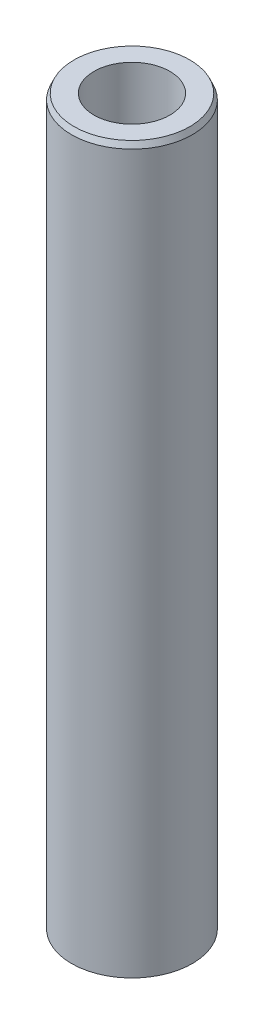
from build123d import *
from OCP.BRepFilletAPI import BRepFilletAPI_MakeChamfer

# Parameters (mm, degrees)
SKETCH1_R           = 27.5
BOSS_EXTRUDE1_DEPTH = 330.461544823
SKETCH2_R           = 17.26713165
CUT_EXTRUDE1_DEPTH  = 333.742141315
CHAMFER1_SIZE       = 2.609505567
CHAMFER1_SIZE2      = 1.168457608


with BuildPart() as part:
    # Sketch1 → Boss-Extrude1 (new body)
    with BuildSketch(Plane(origin=(0, 0, 0), x_dir=(1, 0, 0), z_dir=(0, 1, 0))):
        Circle(SKETCH1_R)
    extrude(amount=BOSS_EXTRUDE1_DEPTH)

    # Sketch2 → Cut-Extrude1 (cut, through all)
    with BuildSketch(Plane(origin=(0, 0, 0), x_dir=(1, 0, 0), z_dir=(0, 1, 0))):
        Circle(SKETCH2_R)
    extrude(amount=CUT_EXTRUDE1_DEPTH, mode=Mode.SUBTRACT)

    # Chamfer1: one chamfer whose edges measure the first distance from different faces: ONE call of the kernel's chamfer builder (chamfer() names one face for all edges)
    chamfer1_edges_1 = [part.edges().sort_by_distance(p)[0] for p in [
        (-27.5, 330.461544823, 0),
    ]]
    chamfer1_side_1 = [part.faces().sort_by_distance(p)[0] for p in [
        (-27.5, 165.230772412, 0),
    ]]
    chamfer1_edges_2 = [part.edges().sort_by_distance(p)[0] for p in [
        (-27.5, 0, 0),
    ]]
    chamfer1_side_2 = [part.faces().sort_by_distance(p)[0] for p in [
        (-26.722182541, 0, 0),
    ]]
    chamfer1 = BRepFilletAPI_MakeChamfer(part.part.solid().wrapped)
    for e in chamfer1_edges_1:
        chamfer1.Add(CHAMFER1_SIZE, CHAMFER1_SIZE2, e.wrapped, chamfer1_side_1[0].wrapped)  # the first distance lies on this face
    for e in chamfer1_edges_2:
        chamfer1.Add(CHAMFER1_SIZE, CHAMFER1_SIZE2, e.wrapped, chamfer1_side_2[0].wrapped)  # the first distance lies on this face
    add(Compound.cast(chamfer1.Shape()), mode=Mode.REPLACE)


solid = part.part
